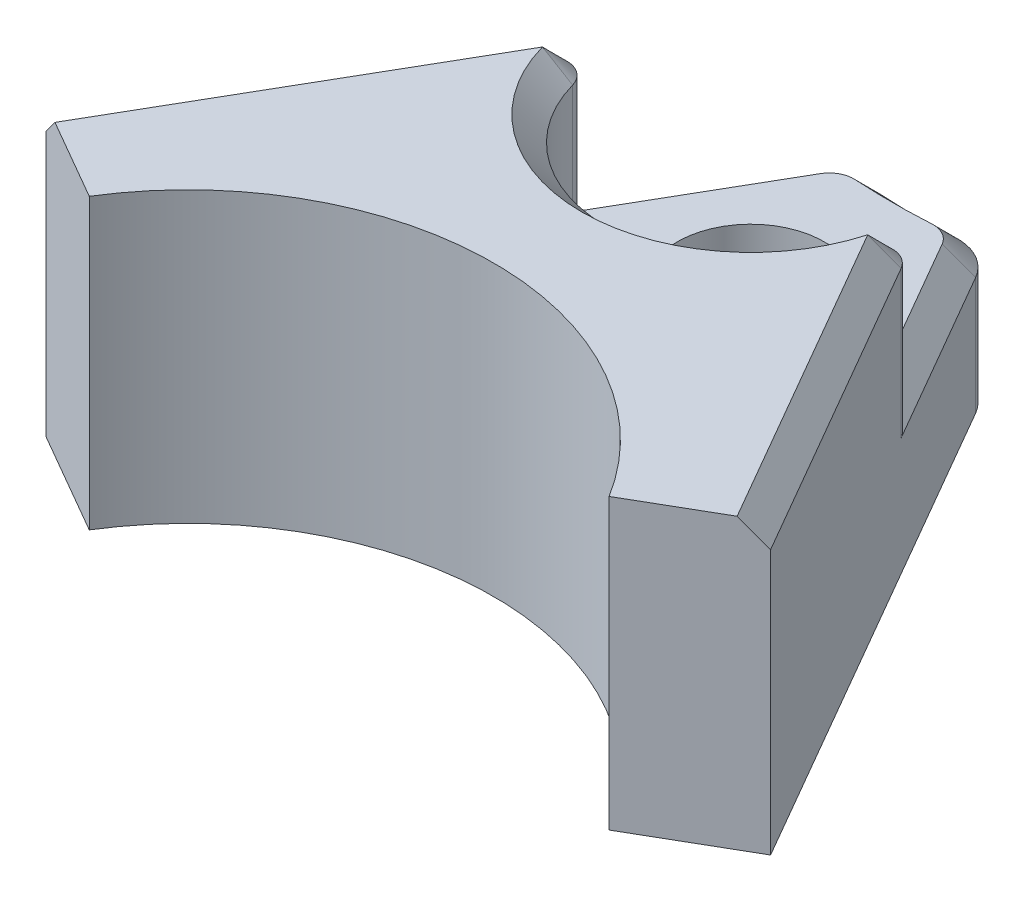
from build123d import *

# Parameters (mm, degrees)
SKETCH1_R                = 1.5
BASE_DEPTH               = 5.9
FASTENER_START           = -3
FASTENER_CLEARANCE_DEPTH = 3
FASTENER_FILLET_R        = 0.5
BASE_FILLET_R            = 1
BODY_CHAMFER_SIZE        = 0.5


with BuildPart() as part:
    # Sketch1 → Base (new body)
    with BuildSketch(Plane(origin=(0, 0, 0), x_dir=(1, 0, 0), z_dir=(0, 1, 0))):
        with BuildLine():
            Line((5.307777313, 3.3), (7.397782409, 4.506665005))
            Line((7.397782409, 4.506665005), (1.360112218, 14.964216534))
            ThreePointArc((1.360112218, 14.964216534), (0, 14.89), (-1.360112218, 14.964216534))
            Line((-1.360112218, 14.964216534), (-7.397782409, 4.506665005))
            Line((-7.397782409, 4.506665005), (-5.307777313, 3.3))
            ThreePointArc((-5.307777313, 3.3), (0, 6.25), (5.307777313, 3.3))
        make_face()
        with Locations((0, 11.5)):
            Circle(SKETCH1_R, mode=Mode.SUBTRACT)
    extrude(amount=BASE_DEPTH)

    # Sketch2 → Fastener Clearance (cut)
    with BuildSketch(Plane(origin=(0, 5.9, 0), x_dir=(1, 0, 0), z_dir=(0, 1, 0)).offset(FASTENER_START)):
        with BuildLine():
            Line((-2.762208294, 12.535714894), (-1.360112218, 14.964216534))
            ThreePointArc((-1.360112218, 14.964216534), (0, 14.89), (1.360112218, 14.964216534))
            Line((1.360112218, 14.964216534), (2.762208294, 12.535714894))
            ThreePointArc((2.762208294, 12.535714894), (0, 8.55), (-2.762208294, 12.535714894))
        make_face()
    extrude(amount=FASTENER_CLEARANCE_DEPTH, mode=Mode.SUBTRACT)

    # Fastener Fillet
    fastener_fillet_edges = [part.edges().sort_by_distance(p)[0] for p in [
        (2.762208294, 4.4, -12.535714894),
        (-2.762208294, 4.4, -12.535714894),
    ]]
    fillet(fastener_fillet_edges, radius=FASTENER_FILLET_R)

    # Base Fillet
    base_fillet_edges = [part.edges().sort_by_distance(p)[0] for p in [
        (-1.360112218, 1.45, -14.964216534),
        (1.360112218, 1.45, -14.964216534),
    ]]
    fillet(base_fillet_edges, radius=BASE_FILLET_R)

    # Body Chamfer
    body_chamfer_edges = [part.edges().sort_by_distance(p)[0] for p in [
        (-2.716008612, 2.9, -12.61573509),
        (-1.285248704, 2.9, -14.795081779),
        (0, 2.9, -14.89),
        (1.285248704, 2.9, -14.795081779),
        (2.716008612, 2.9, -12.61573509),
        (-5.576129132, 5.9, -7.661861034),
        (-3.259182505, 5.9, -11.063163021),
        (0, 5.9, -8.55),
        (3.259182505, 5.9, -11.063163021),
        (5.576129132, 5.9, -7.661861034),
    ]]
    chamfer(body_chamfer_edges, length=BODY_CHAMFER_SIZE)


solid = part.part
